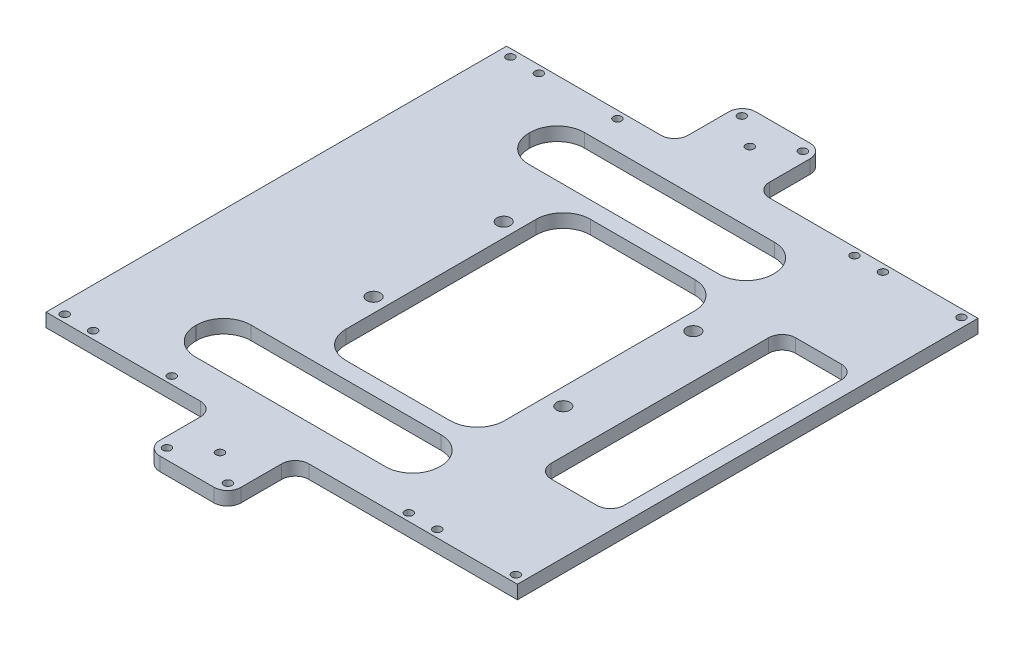
from build123d import *

# Parameters (mm, degrees)
SKETCH_1_R          = 1.5
SKETCH_1_R_2        = 2.5
EXTRUDE_1_DEPTH     = 5
CUT_EXTRUDE_1_DEPTH = 167.58331249


with BuildPart() as part:
    # 草图1 → 凸台-拉伸1 (new body)
    with BuildSketch(Plane(origin=(0, 0, 0), x_dir=(1, 0, 0), z_dir=(0, 1, 0))):
        with BuildLine():
            Line((-125, 85), (-67.999242617, 85))
            ThreePointArc((-67.999242617, 85), (-64.463708711, 86.464466094), (-62.999242617, 90))
            Line((-62.999242617, 90), (-62.999242617, 105))
            ThreePointArc((-62.999242617, 105), (-61.534776523, 108.535533906), (-57.999242617, 110))
            Line((-57.999242617, 110), (-37.999242617, 110))
            ThreePointArc((-37.999242617, 110), (-34.463708711, 108.535533906), (-32.999242617, 105))
            Line((-32.999242617, 105), (-32.999242617, 90))
            ThreePointArc((-32.999242617, 90), (-31.534776523, 86.464466094), (-27.999242617, 85))
            Line((-27.999242617, 85), (49.000757383, 85))
            Line((49.000757383, 85), (49.000757383, -85))
            Line((49.000757383, -85), (-27.999242617, -85))
            ThreePointArc((-27.999242617, -85), (-31.534776523, -86.464466094), (-32.999242617, -90))
            Line((-32.999242617, -90), (-32.999242617, -105))
            ThreePointArc((-32.999242617, -105), (-34.463708711, -108.535533906), (-37.999242617, -110))
            Line((-37.999242617, -110), (-57.999242617, -110))
            ThreePointArc((-57.999242617, -110), (-61.534776523, -108.535533906), (-62.999242617, -105))
            Line((-62.999242617, -105), (-62.999242617, -90))
            ThreePointArc((-62.999242617, -90), (-64.463708711, -86.464466094), (-67.999242617, -85))
            Line((-67.999242617, -85), (-125, -85))
            Line((-125, -85), (-125, 85))
        make_face()
        with Locations((-120.84, -82.25)):
            Circle(SKETCH_1_R, mode=Mode.SUBTRACT)
        with Locations((-110.34, -82.25)):
            Circle(SKETCH_1_R, mode=Mode.SUBTRACT)
        with Locations((-81.34, -82.25)):
            Circle(SKETCH_1_R, mode=Mode.SUBTRACT)
        with Locations((-81.34, 82.25)):
            Circle(SKETCH_1_R, mode=Mode.SUBTRACT)
        with Locations((-110.34, 82.25)):
            Circle(SKETCH_1_R, mode=Mode.SUBTRACT)
        with Locations((-120.84, 82.25)):
            Circle(SKETCH_1_R, mode=Mode.SUBTRACT)
        with Locations((6.16, 82.25)):
            Circle(SKETCH_1_R, mode=Mode.SUBTRACT)
        with Locations((16.66, 82.25)):
            Circle(SKETCH_1_R, mode=Mode.SUBTRACT)
        with Locations((45.66, 82.25)):
            Circle(SKETCH_1_R, mode=Mode.SUBTRACT)
        with Locations((6.16, -82.25)):
            Circle(SKETCH_1_R, mode=Mode.SUBTRACT)
        with Locations((16.66, -82.25)):
            Circle(SKETCH_1_R, mode=Mode.SUBTRACT)
        with Locations((45.66, -82.25)):
            Circle(SKETCH_1_R, mode=Mode.SUBTRACT)
        with Locations((-69.422345539, 28.355497102)):
            Circle(SKETCH_1_R_2, mode=Mode.SUBTRACT)
        with Locations((0.577654461, 28.355497102)):
            Circle(SKETCH_1_R_2, mode=Mode.SUBTRACT)
        with Locations((-69.422345539, -19.644502898)):
            Circle(SKETCH_1_R_2, mode=Mode.SUBTRACT)
        with Locations((0.577654461, -19.644502898)):
            Circle(SKETCH_1_R_2, mode=Mode.SUBTRACT)
        with Locations((-59.249242617, -106.1)):
            Circle(SKETCH_1_R, mode=Mode.SUBTRACT)
        with Locations((-36.749242617, -106.1)):
            Circle(SKETCH_1_R, mode=Mode.SUBTRACT)
        with Locations((-47.999242617, -97.789393477)):
            Circle(SKETCH_1_R, mode=Mode.SUBTRACT)
        with Locations((-36.749242617, 106.1)):
            Circle(SKETCH_1_R, mode=Mode.SUBTRACT)
        with Locations((-59.249242617, 106.1)):
            Circle(SKETCH_1_R, mode=Mode.SUBTRACT)
        with Locations((-47.999242617, 97.789393477)):
            Circle(SKETCH_1_R, mode=Mode.SUBTRACT)
        with BuildLine():
            Line((-12.914937196, -51.31082178), (-83.083548039, -51.31082178))
            ThreePointArc((-83.083548039, -51.31082178), (-90.154615851, -54.239753968), (-93.083548039, -61.31082178))
            Line((-93.083548039, -61.31082178), (-93.083548039, -61.770331604))
            ThreePointArc((-93.083548039, -61.770331604), (-90.154615851, -68.841399416), (-83.083548039, -71.770331604))
            Line((-83.083548039, -71.770331604), (-12.914937196, -71.770331604))
            ThreePointArc((-12.914937196, -71.770331604), (-5.843869384, -68.841399416), (-2.914937196, -61.770331604))
            Line((-2.914937196, -61.770331604), (-2.914937196, -61.31082178))
            ThreePointArc((-2.914937196, -61.31082178), (-5.843869384, -54.239753968), (-12.914937196, -51.31082178))
        make_face(mode=Mode.SUBTRACT)
        with BuildLine():
            Line((-12.914937196, 71.770331604), (-83.083548039, 71.770331604))
            ThreePointArc((-83.083548039, 71.770331604), (-90.154615851, 68.841399416), (-93.083548039, 61.770331604))
            Line((-93.083548039, 61.770331604), (-93.083548039, 61.31082178))
            ThreePointArc((-93.083548039, 61.31082178), (-90.154615851, 54.239753968), (-83.083548039, 51.31082178))
            Line((-83.083548039, 51.31082178), (-12.914937196, 51.31082178))
            ThreePointArc((-12.914937196, 51.31082178), (-5.843869384, 54.239753968), (-2.914937196, 61.31082178))
            Line((-2.914937196, 61.31082178), (-2.914937196, 61.770331604))
            ThreePointArc((-2.914937196, 61.770331604), (-5.843869384, 68.841399416), (-12.914937196, 71.770331604))
        make_face(mode=Mode.SUBTRACT)
        with BuildLine():
            Line((-15.665960641, 45.130463402), (-54.200019018, 45.130463402))
            ThreePointArc((-54.200019018, 45.130463402), (-61.27108683, 42.201531214), (-64.200019018, 35.130463402))
            Line((-64.200019018, 35.130463402), (-64.200019018, -35.130463402))
            ThreePointArc((-64.200019018, -35.130463402), (-61.27108683, -42.201531214), (-54.200019018, -45.130463402))
            Line((-54.200019018, -45.130463402), (-15.665960641, -45.130463402))
            ThreePointArc((-15.665960641, -45.130463402), (-8.594892829, -42.201531214), (-5.665960641, -35.130463402))
            Line((-5.665960641, -35.130463402), (-5.665960641, 35.130463402))
            ThreePointArc((-5.665960641, 35.130463402), (-8.594892829, 42.201531214), (-15.665960641, 45.130463402))
        make_face(mode=Mode.SUBTRACT)
    extrude(amount=EXTRUDE_1_DEPTH)

    # 草图2 → 切除-拉伸1 (cut, through all)
    with BuildSketch(Plane.XZ):
        with BuildLine():
            Line((21.556311208, 45.130463402), (38.464260393, 45.130463402))
            ThreePointArc((38.464260393, 45.130463402), (41.999794299, 43.665997308), (43.464260393, 40.130463402))
            Line((43.464260393, 40.130463402), (43.464260393, -40.130463402))
            ThreePointArc((43.464260393, -40.130463402), (41.999794299, -43.665997308), (38.464260393, -45.130463402))
            Line((38.464260393, -45.130463402), (21.556311208, -45.130463402))
            ThreePointArc((21.556311208, -45.130463402), (18.020777302, -43.665997308), (16.556311208, -40.130463402))
            Line((16.556311208, -40.130463402), (16.556311208, 40.130463402))
            ThreePointArc((16.556311208, 40.130463402), (18.020777302, 43.665997308), (21.556311208, 45.130463402))
        make_face()
    extrude(amount=-CUT_EXTRUDE_1_DEPTH, mode=Mode.SUBTRACT)


solid = part.part
